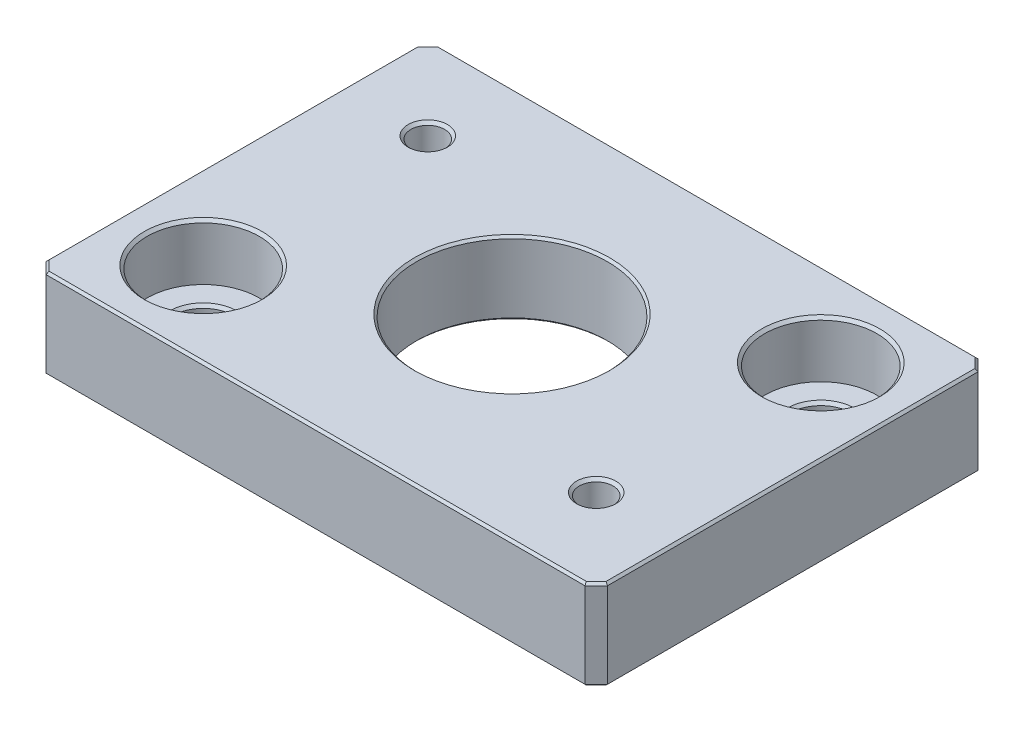
from build123d import *

# Parameters (mm, degrees)
SKETCH1_W                      = 50
SKETCH1_H                      = 35
SKETCH1_R                      = 8.5
BOSS_EXTRUDE1_DEPTH            = 8
F_3_0MM_DOWEL_HOLE1_AT_2_COUNT = 2
F_3_0MM_DOWEL_HOLE1_AT_2_PITCH = 40.311288741
CBORE_FOR_M5_SHCS1_AT_2_COUNT  = 2
CBORE_FOR_M5_SHCS1_AT_2_PITCH  = 40.311288741
SKETCH6_R                      = 11.5
CUT_EXTRUDE1_DEPTH             = 1.5
CHAMFER1_SIZE                  = 1
CHAMFER2_SIZE                  = 0.2


with BuildPart() as part:
    # Sketch1 → Boss-Extrude1 (new body)
    with BuildSketch(Plane(origin=(0, 0, 0), x_dir=(1, 0, 0), z_dir=(0, 1, 0))):
        Rectangle(SKETCH1_W, SKETCH1_H)
        Circle(SKETCH1_R, mode=Mode.SUBTRACT)
    extrude(amount=BOSS_EXTRUDE1_DEPTH)

    # Sketch3 → Ø3.0mm Dowel Hole1 (revolve, cut)
    with BuildSketch(Plane(origin=(-17.5, 8, -10), x_dir=(0, 0, 1), z_dir=(1, 0, 0))):
        Polygon((0, 0), (0, 8), (1.75, 8), (1.5, 7.75), (1.5, 0.25), (1.75, 0), align=None)
    f_3_0mm_dowel_hole1 = revolve(axis=Axis((-17.5, 14.35, -10), (0, -1, 0)), mode=Mode.SUBTRACT)

    # Ø3.0mm Dowel Hole1 at 2: Ø3.0mm Dowel Hole1 ×2
    with Locations(*[Vector(0.8682431421244593, 0, 0.49613893835683387) * (i * F_3_0MM_DOWEL_HOLE1_AT_2_PITCH) for i in range(1, F_3_0MM_DOWEL_HOLE1_AT_2_COUNT)]):
        add(f_3_0mm_dowel_hole1, mode=Mode.SUBTRACT)

    # Sketch5 → CBORE for M5 SHCS1 (revolve, cut)
    with BuildSketch(Plane(origin=(17.5, 8, -10), x_dir=(0, 0, 1), z_dir=(1, 0, 0))):
        Polygon((0, 0), (0, 8), (3, 8), (2.75, 7.75), (2.75, 5.25), (3, 5), (5, 5), (5, 0.25), (5.25, 0), align=None)
    cbore_for_m5_shcs1 = revolve(axis=Axis((17.5, 14.35, -10), (0, -1, 0)), mode=Mode.SUBTRACT)

    # CBORE for M5 SHCS1 at 2: CBORE for M5 SHCS1 ×2
    with Locations(*[Vector(-0.8682431421244593, 0, 0.49613893835683387) * (i * CBORE_FOR_M5_SHCS1_AT_2_PITCH) for i in range(1, CBORE_FOR_M5_SHCS1_AT_2_COUNT)]):
        add(cbore_for_m5_shcs1, mode=Mode.SUBTRACT)

    # Sketch6 → Cut-Extrude1 (cut)
    with BuildSketch(Plane(origin=(0, 0, 0), x_dir=(1, 0, 0), z_dir=(0, 1, 0))):
        Circle(SKETCH6_R)
    extrude(amount=CUT_EXTRUDE1_DEPTH, mode=Mode.SUBTRACT)

    # Chamfer1
    chamfer1_edges = [part.edges().sort_by_distance(p)[0] for p in [
        (25, 4, -17.5),
        (25, 4, 17.5),
        (-25, 4, -17.5),
        (-25, 4, 17.5),
    ]]
    chamfer(chamfer1_edges, length=CHAMFER1_SIZE)

    # Chamfer2
    chamfer2_edges = [part.edges().sort_by_distance(p)[0] for p in [
        (-24.5, 0, -17),
        (-25, 0, 0),
        (-24.5, 0, 17),
        (0, 0, 17.5),
        (24.5, 0, 17),
        (25, 0, 0),
        (24.5, 0, -17),
        (0, 0, -17.5),
        (-8.5, 8, 0),
        (24.5, 8, 17),
        (0, 8, 17.5),
        (-24.5, 8, 17),
        (-25, 8, 0),
        (-24.5, 8, -17),
        (0, 8, -17.5),
        (24.5, 8, -17),
        (25, 8, 0),
        (-8.5, 1.5, 0),
        (-11.5, 0, 0),
    ]]
    chamfer(chamfer2_edges, length=CHAMFER2_SIZE)


solid = part.part
